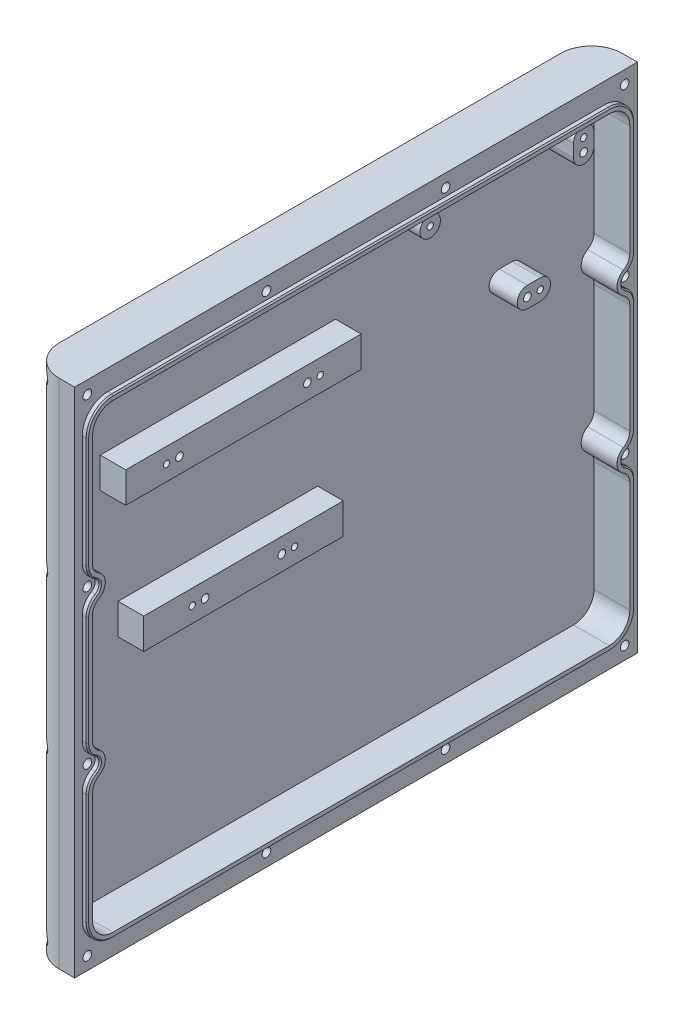
from build123d import *

# Parameters (mm, degrees)
SKETCH1_W                 = 220
SKETCH1_H                 = 200
BOSS_EXTRUDE1_DEPTH       = 6
SKETCH1_3_W               = 220
SKETCH1_3_H               = 200
BOSS_EXTRUDE2_DEPTH       = 18
SKETCH2_R                 = 4
BOSS_EXTRUDE3_DEPTH       = 11
SKETCH3_R                 = 1.2295
CUT_EXTRUDE1_DEPTH        = 7
F_3_0MM_DOWEL_HOLE1_D     = 3
F_3_0MM_DOWEL_HOLE1_DEPTH = 5
F_3_0MM_DOWEL_HOLE1_TIP   = 0.901290929
SKETCH6_W                 = 92
SKETCH6_H                 = 12
SKETCH6_W_2               = 78
BOSS_EXTRUDE4_DEPTH       = 10
SKETCH7_R                 = 1.2295
CUT_EXTRUDE2_DEPTH        = 7
F_3_0MM_DOWEL_HOLE2_D     = 3
F_3_0MM_DOWEL_HOLE2_DEPTH = 4
F_3_0MM_DOWEL_HOLE2_TIP   = 0.901290929
FILLET1_R                 = 8
FILLET2_R                 = 5
BOSS_EXTRUDE5_START       = 2
BOSS_EXTRUDE5_DEPTH       = 2
CHAMFER1_SIZE             = 0.5
SKETCH12_R                = 1.7
CUT_EXTRUDE3_DEPTH        = 18
SKETCH13_R                = 3.25
CUT_EXTRUDE4_DEPTH        = 12
FILLET3_START             = -101
FILLET3_DEPTH             = 202


with BuildPart() as part:
    # Sketch1 → Boss-Extrude1 (new body)
    with BuildSketch(Plane(origin=(0, 0, 0), x_dir=(0, 0, -1), z_dir=(1, 0, 0))):
        Rectangle(SKETCH1_W, SKETCH1_H)
    extrude(amount=BOSS_EXTRUDE1_DEPTH)

    # Sketch1<3> → Boss-Extrude2 (add)
    with BuildSketch(Plane(origin=(0, 0, 0), x_dir=(0, 0, -1), z_dir=(1, 0, 0))):
        Rectangle(SKETCH1_3_W, SKETCH1_3_H)
        with BuildLine():
            Line((-105, 25), (-105, -25))
            ThreePointArc((-105, -25), (-100, -30), (-105, -35))
            Line((-105, -35), (-105, -90))
            Line((-105, -90), (105, -90))
            Line((105, -90), (105, -35))
            ThreePointArc((105, -35), (100, -30), (105, -25))
            Line((105, -25), (105, 25))
            ThreePointArc((105, 25), (100, 30), (105, 35))
            Line((105, 35), (105, 90))
            Line((105, 90), (-105, 90))
            Line((-105, 90), (-105, 35))
            ThreePointArc((-105, 35), (-100, 30), (-105, 25))
        make_face(mode=Mode.SUBTRACT)
    extrude(amount=BOSS_EXTRUDE2_DEPTH)

    # Sketch2 → Boss-Extrude3 (add)
    with BuildSketch(Plane(origin=(6, 0, 0), x_dir=(0, 0, -1), z_dir=(1, 0, 0))):
        with Locations(Location((30, 84, 0), (0, 0, 180))):
            Circle(SKETCH2_R)
        with BuildLine():
            Line((94, 84), (94, 79))
            ThreePointArc((94, 79), (90, 75), (86, 79))
            Line((86, 79), (86, 84))
            ThreePointArc((86, 84), (90, 88), (94, 84))
        make_face()
        with BuildLine():
            Line((68, 45), (73, 45))
            ThreePointArc((73, 45), (77, 41), (73, 37))
            Line((73, 37), (68, 37))
            ThreePointArc((68, 37), (64, 41), (68, 45))
        make_face()
    extrude(amount=BOSS_EXTRUDE3_DEPTH)

    # Sketch3 → Cut-Extrude1 (cut)
    with BuildSketch(Plane(origin=(17, 0, 0), x_dir=(0, 0, -1), z_dir=(1, 0, 0))):
        with Locations((30, 84)):
            Circle(SKETCH3_R)
        with Locations((90, 84)):
            Circle(SKETCH3_R)
        with Locations((73, 41)):
            Circle(SKETCH3_R)
    extrude(amount=-CUT_EXTRUDE1_DEPTH, mode=Mode.SUBTRACT)

    # Ø3.0mm Dowel Hole1
    with Locations(Plane(origin=(17, 0, 0), x_dir=(0, 0, -1), z_dir=(1, 0, 0))):
        with Locations((68, 41), (90, 79)):
            Hole(F_3_0MM_DOWEL_HOLE1_D / 2, depth=F_3_0MM_DOWEL_HOLE1_DEPTH)
            with Locations((0, 0, -(F_3_0MM_DOWEL_HOLE1_DEPTH + F_3_0MM_DOWEL_HOLE1_TIP / 2))):  # 118° drill point
                Cone(0, F_3_0MM_DOWEL_HOLE1_D / 2, F_3_0MM_DOWEL_HOLE1_TIP, mode=Mode.SUBTRACT)

    # Sketch6 → Boss-Extrude4 (add)
    with BuildSketch(Plane(origin=(6, 0, 0), x_dir=(0, 0, -1), z_dir=(1, 0, 0))):
        with Locations((-42, 54)):
            Rectangle(SKETCH6_W, SKETCH6_H)
        with Locations((-42, 1)):
            Rectangle(SKETCH6_W_2, SKETCH6_H)
    extrude(amount=BOSS_EXTRUDE4_DEPTH)

    # Sketch7 → Cut-Extrude2 (cut)
    with BuildSketch(Plane(origin=(16, 0, 0), x_dir=(0, 0, -1), z_dir=(1, 0, 0))):
        with Locations((-72, 54)):
            Circle(SKETCH7_R)
        with Locations((-12, 54)):
            Circle(SKETCH7_R)
        with Locations((-62, 1)):
            Circle(SKETCH7_R)
        with Locations((-22, 1)):
            Circle(SKETCH7_R)
    extrude(amount=-CUT_EXTRUDE2_DEPTH, mode=Mode.SUBTRACT)

    # Ø3.0mm Dowel Hole2
    with Locations(Plane(origin=(16, 0, 0), x_dir=(0, 0, -1), z_dir=(1, 0, 0))):
        with Locations((-67, 54), (-17, 54), (-57, 1), (-27, 1)):
            Hole(F_3_0MM_DOWEL_HOLE2_D / 2, depth=F_3_0MM_DOWEL_HOLE2_DEPTH)
            with Locations((0, 0, -(F_3_0MM_DOWEL_HOLE2_DEPTH + F_3_0MM_DOWEL_HOLE2_TIP / 2))):  # 118° drill point
                Cone(0, F_3_0MM_DOWEL_HOLE2_D / 2, F_3_0MM_DOWEL_HOLE2_TIP, mode=Mode.SUBTRACT)

    # Fillet1
    fillet1_edges = [part.edges().sort_by_distance(p)[0] for p in [
        (12, 90, -105),
        (12, 90, 105),
        (12, -90, 105),
        (12, -90, -105),
    ]]
    fillet(fillet1_edges, radius=FILLET1_R)

    # Fillet2
    fillet2_edges = [part.edges().sort_by_distance(p)[0] for p in [
        (12, -35, -105),
        (12, -25, -105),
        (12, 25, -105),
        (12, 35, -105),
        (12, 35, 105),
        (12, 25, 105),
        (12, -25, 105),
        (12, -35, 105),
    ]]
    fillet(fillet2_edges, radius=FILLET2_R)

    # Sketch11 → Boss-Extrude5 (add)
    with BuildSketch(Plane(origin=(18, 0, 0), x_dir=(0, 0, -1), z_dir=(1, 0, 0)).offset(BOSS_EXTRUDE5_START)):
        with BuildLine():
            Line((107, -82), (107, -38.660254038))
            ThreePointArc((107, -38.660254038), (106.062177826, -35.160254038), (103.5, -32.598076211))
            ThreePointArc((103.5, -32.598076211), (102, -30), (103.5, -27.401923789))
            ThreePointArc((103.5, -27.401923789), (106.062177826, -24.839745962), (107, -21.339745962))
            Line((107, -21.339745962), (107, 21.339745962))
            ThreePointArc((107, 21.339745962), (106.062177826, 24.839745962), (103.5, 27.401923789))
            ThreePointArc((103.5, 27.401923789), (102, 30), (103.5, 32.598076211))
            ThreePointArc((103.5, 32.598076211), (106.062177826, 35.160254038), (107, 38.660254038))
            Line((107, 38.660254038), (107, 82))
            ThreePointArc((107, 82), (104.071067812, 89.071067812), (97, 92))
            Line((97, 92), (-97, 92))
            ThreePointArc((-97, 92), (-104.071067812, 89.071067812), (-107, 82))
            Line((-107, 82), (-107, 38.660254038))
            ThreePointArc((-107, 38.660254038), (-106.062177826, 35.160254038), (-103.5, 32.598076211))
            ThreePointArc((-103.5, 32.598076211), (-102, 30), (-103.5, 27.401923789))
            ThreePointArc((-103.5, 27.401923789), (-106.062177826, 24.839745962), (-107, 21.339745962))
            Line((-107, 21.339745962), (-107, -21.339745962))
            ThreePointArc((-107, -21.339745962), (-106.062177826, -24.839745962), (-103.5, -27.401923789))
            ThreePointArc((-103.5, -27.401923789), (-102, -30), (-103.5, -32.598076211))
            ThreePointArc((-103.5, -32.598076211), (-106.062177826, -35.160254038), (-107, -38.660254038))
            Line((-107, -38.660254038), (-107, -82))
            ThreePointArc((-107, -82), (-104.071067812, -89.071067812), (-97, -92))
            Line((-97, -92), (97, -92))
            ThreePointArc((97, -92), (104.071067812, -89.071067812), (107, -82))
        make_face()
        with BuildLine():
            Line((105, -21.339745962), (105, 21.339745962))
            ThreePointArc((105, 21.339745962), (104.330127019, 23.839745962), (102.5, 25.669872981))
            ThreePointArc((102.5, 25.669872981), (100, 30), (102.5, 34.330127019))
            ThreePointArc((102.5, 34.330127019), (104.330127019, 36.160254038), (105, 38.660254038))
            Line((105, 38.660254038), (105, 82))
            ThreePointArc((105, 82), (102.656854249, 87.656854249), (97, 90))
            Line((97, 90), (-97, 90))
            ThreePointArc((-97, 90), (-102.656854249, 87.656854249), (-105, 82))
            Line((-105, 82), (-105, 38.660254038))
            ThreePointArc((-105, 38.660254038), (-104.330127019, 36.160254038), (-102.5, 34.330127019))
            ThreePointArc((-102.5, 34.330127019), (-100, 30), (-102.5, 25.669872981))
            ThreePointArc((-102.5, 25.669872981), (-104.330127019, 23.839745962), (-105, 21.339745962))
            Line((-105, 21.339745962), (-105, -21.339745962))
            ThreePointArc((-105, -21.339745962), (-104.330127019, -23.839745962), (-102.5, -25.669872981))
            ThreePointArc((-102.5, -25.669872981), (-100, -30), (-102.5, -34.330127019))
            ThreePointArc((-102.5, -34.330127019), (-104.330127019, -36.160254038), (-105, -38.660254038))
            Line((-105, -38.660254038), (-105, -82))
            ThreePointArc((-105, -82), (-102.656854249, -87.656854249), (-97, -90))
            Line((-97, -90), (97, -90))
            ThreePointArc((97, -90), (102.656854249, -87.656854249), (105, -82))
            Line((105, -82), (105, -38.660254038))
            ThreePointArc((105, -38.660254038), (104.330127019, -36.160254038), (102.5, -34.330127019))
            ThreePointArc((102.5, -34.330127019), (100, -30), (102.5, -25.669872981))
            ThreePointArc((102.5, -25.669872981), (104.330127019, -23.839745962), (105, -21.339745962))
        make_face(mode=Mode.SUBTRACT)
    extrude(amount=-BOSS_EXTRUDE5_DEPTH)

    # Chamfer1
    chamfer1_edges = [part.edges().sort_by_distance(p)[0] for p in [
        (20, -24.839745962, -106.062177826),
        (20, 0, -107),
        (20, 24.839745962, -106.062177826),
        (20, 30, -102),
        (20, 35.160254038, -106.062177826),
        (20, 60.330127019, -107),
        (20, 89.071067812, -104.071067812),
        (20, 92, 0),
        (20, 89.071067812, 104.071067812),
        (20, 60.330127019, 107),
        (20, 35.160254038, 106.062177826),
        (20, 30, 102),
        (20, 24.839745962, 106.062177826),
        (20, 0, 107),
        (20, -24.839745962, 106.062177826),
        (20, -30, 102),
        (20, -35.160254038, 106.062177826),
        (20, -60.330127019, 107),
        (20, -89.071067812, 104.071067812),
        (20, -92, 0),
        (20, -89.071067812, -104.071067812),
        (20, -60.330127019, -107),
        (20, -35.160254038, -106.062177826),
        (20, -30, -102),
    ]]
    chamfer(chamfer1_edges, length=CHAMFER1_SIZE)

    # Sketch12 → Cut-Extrude3 (cut)
    with BuildSketch(Plane(origin=(18, 0, 0), x_dir=(0, 0, -1), z_dir=(1, 0, 0))):
        with Locations((-105, 95)):
            Circle(SKETCH12_R)
        with Locations((-105, 30)):
            Circle(SKETCH12_R)
        with Locations((-105, -30)):
            Circle(SKETCH12_R)
        with Locations((-105, -95)):
            Circle(SKETCH12_R)
        with Locations((-35, -95)):
            Circle(SKETCH12_R)
        with Locations((35, -95)):
            Circle(SKETCH12_R)
        with Locations((105, -95)):
            Circle(SKETCH12_R)
        with Locations((105, -30)):
            Circle(SKETCH12_R)
        with Locations((105, 30)):
            Circle(SKETCH12_R)
        with Locations((105, 95)):
            Circle(SKETCH12_R)
        with Locations((-35, 95)):
            Circle(SKETCH12_R)
        with Locations((35, 95)):
            Circle(SKETCH12_R)
    extrude(amount=-CUT_EXTRUDE3_DEPTH, mode=Mode.SUBTRACT)

    # Sketch13 → Cut-Extrude4 (cut)
    with BuildSketch(Plane.ZY):
        with Locations((-105, 95)):
            Circle(SKETCH13_R)
        with Locations((-35, 95)):
            Circle(SKETCH13_R)
        with Locations((35, 95)):
            Circle(SKETCH13_R)
        with Locations((105, 95)):
            Circle(SKETCH13_R)
        with Locations((105, 30)):
            Circle(SKETCH13_R)
        with Locations((105, -30)):
            Circle(SKETCH13_R)
        with Locations((105, -95)):
            Circle(SKETCH13_R)
        with Locations((35, -95)):
            Circle(SKETCH13_R)
        with Locations((-35, -95)):
            Circle(SKETCH13_R)
        with Locations((-105, -95)):
            Circle(SKETCH13_R)
        with Locations((-105, -30)):
            Circle(SKETCH13_R)
        with Locations((-105, 30)):
            Circle(SKETCH13_R)
    extrude(amount=-CUT_EXTRUDE4_DEPTH, mode=Mode.SUBTRACT)

    # Fillet3: read off the stored shape, not the designer's step
    # Fillet3 outline → Fillet3 (cut)
    with BuildSketch(Plane(origin=(0, 0, 0), x_dir=(1, 0, 0), z_dir=(0, 1, 0)).offset(FILLET3_START)):
        with BuildLine():
            Line((0, 110), (0, 98))
            ThreePointArc((0, 98), (3.514718626, 106.485281374), (12, 110))
            Line((12, 110), (0, 110))
        make_face()
        with BuildLine():
            ThreePointArc((12, -110), (3.514718626, -106.485281374), (0, -98))
            Line((0, -98), (0, -110))
            Line((0, -110), (12, -110))
        make_face()
    extrude(amount=FILLET3_DEPTH, mode=Mode.SUBTRACT)


solid = part.part
